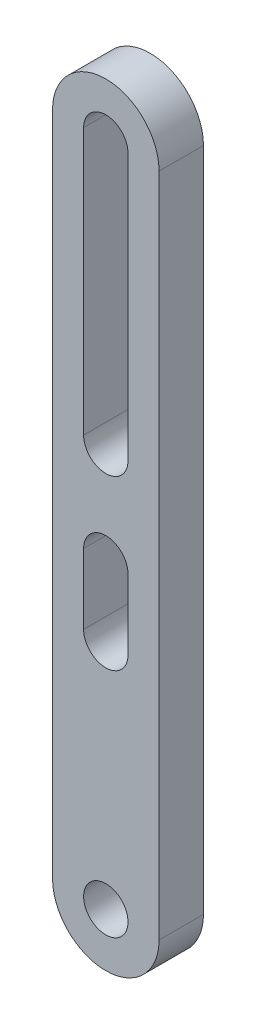
from build123d import *

# Parameters (mm, degrees)
SKETCH1_R           = 2.5
BOSS_EXTRUDE1_DEPTH = 5


with BuildPart() as part:
    # Sketch1 → Boss-Extrude1 (new body)
    with BuildSketch(Plane.XY):
        with BuildLine():
            Line((-6, 75), (-6, 0))
            ThreePointArc((-6, 0), (0, -6), (6, 0))
            Line((6, 0), (6, 75))
            ThreePointArc((6, 75), (0, 81), (-6, 75))
        make_face()
        Circle(SKETCH1_R, mode=Mode.SUBTRACT)
        with BuildLine():
            Line((-2.5, 75), (-2.5, 45))
            ThreePointArc((-2.5, 45), (0, 42.5), (2.5, 45))
            Line((2.5, 45), (2.5, 75))
            ThreePointArc((2.5, 75), (0, 77.5), (-2.5, 75))
        make_face(mode=Mode.SUBTRACT)
        with BuildLine():
            Line((2.5, 33.948576385), (2.5, 26.051423615))
            ThreePointArc((2.5, 26.051423615), (0, 23.551423615), (-2.5, 26.051423615))
            Line((-2.5, 26.051423615), (-2.5, 33.948576385))
            ThreePointArc((-2.5, 33.948576385), (0, 36.448576385), (2.5, 33.948576385))
        make_face(mode=Mode.SUBTRACT)
    extrude(amount=BOSS_EXTRUDE1_DEPTH)


solid = part.part
